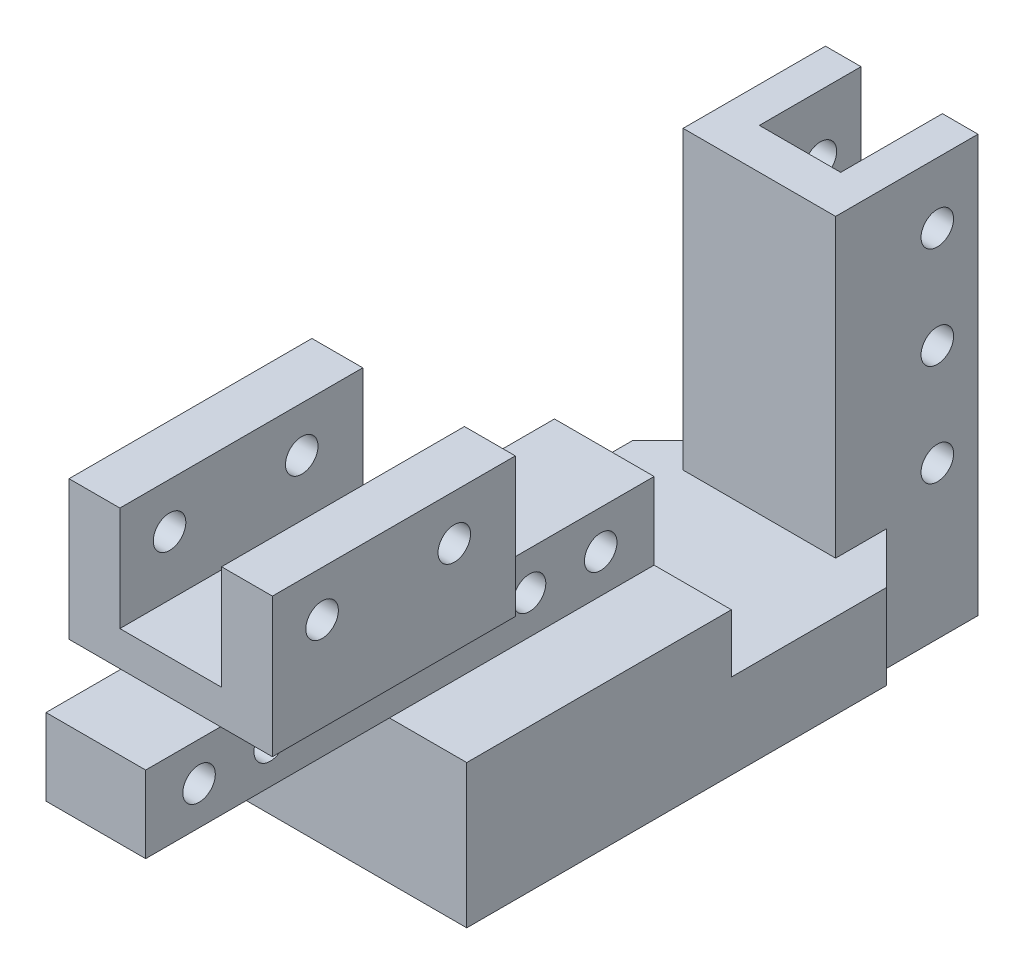
from build123d import *

# Parameters (mm, degrees)
SKETCH_2_W          = 50
SKETCH_2_H          = 7.55
SKETCH_2_R          = 1.6
EXTRUDE_1_DEPTH     = 4.9
SKETCH_3_W          = 23.885574904
SKETCH_3_H          = 13.680093874
SKETCH_3_R          = 1.6
EXTRUDE_2_DEPTH     = 10
SKETCH_4_W          = 10
SKETCH_4_H          = 10.264550668
CUT_EXTRUDE_1_DEPTH = 48.143107127
SKETCH_6_W          = 14
SKETCH_6_H          = 41
SKETCH_6_R          = 1.6
EXTRUDE_4_DEPTH     = 7.5
SKETCH_7_W          = 8
SKETCH_7_H          = 41
CUT_EXTRUDE_2_DEPTH = 10
EXTRUDE_5_DEPTH     = 12.5
CHAMFER_1_SIZE      = 5


with BuildPart() as part:
    # 草图2 → 凸台-拉伸1 (new, symmetric)
    with BuildSketch(Plane(origin=(0, 0, 0), x_dir=(0, 0, -1), z_dir=(1, 0, 0))):
        with Locations((19.75, 0)):
            Rectangle(SKETCH_2_W, SKETCH_2_H)
        Circle(SKETCH_2_R, mode=Mode.SUBTRACT)
        with Locations((7, 0)):
            Circle(SKETCH_2_R, mode=Mode.SUBTRACT)
        with Locations((32.5, 0)):
            Circle(SKETCH_2_R, mode=Mode.SUBTRACT)
        with Locations((39.5, 0)):
            Circle(SKETCH_2_R, mode=Mode.SUBTRACT)
    extrude(amount=EXTRUDE_1_DEPTH, both=True)

    # 草图3 → 凸台-拉伸2 (add, symmetric)
    with BuildSketch(Plane(origin=(0, 0, 0), x_dir=(0, 0, -1), z_dir=(1, 0, 0))):
        with Locations((14.057212548, 10.615046937)):
            Rectangle(SKETCH_3_W, SKETCH_3_H)
        with Locations((7, 13)):
            Circle(SKETCH_3_R, mode=Mode.SUBTRACT)
        with Locations((20, 13)):
            Circle(SKETCH_3_R, mode=Mode.SUBTRACT)
    extrude(amount=EXTRUDE_2_DEPTH, both=True)

    # 草图4 → 切除-拉伸1 (cut, through all)
    with BuildSketch(Plane.XY.offset(-2.114425096)):
        with Locations((0, 12.32281854)):
            Rectangle(SKETCH_4_W, SKETCH_4_H)
    extrude(amount=-CUT_EXTRUDE_1_DEPTH, mode=Mode.SUBTRACT)



with BuildPart() as body_2:
    # 草图6 → 凸台-拉伸4 (new, symmetric)
    with BuildSketch(Plane(origin=(0, 0, 0), x_dir=(0, 0, -1), z_dir=(1, 0, 0))):
        with Locations((67, -0.9)):
            Rectangle(SKETCH_6_W, SKETCH_6_H)
        with Locations((70, 3.6)):
            Circle(SKETCH_6_R, mode=Mode.SUBTRACT)
        with Locations((70, 13.6)):
            Circle(SKETCH_6_R, mode=Mode.SUBTRACT)
        with Locations((70, -6.4)):
            Circle(SKETCH_6_R, mode=Mode.SUBTRACT)
    extrude(amount=EXTRUDE_4_DEPTH, both=True)

    # 草图7 → 切除-拉伸2 (cut)
    with BuildSketch(Plane.XY.offset(-74)):
        with Locations((0, -0.9)):
            Rectangle(SKETCH_7_W, SKETCH_7_H)
    extrude(amount=CUT_EXTRUDE_2_DEPTH, mode=Mode.SUBTRACT)


with BuildPart() as part_1:
    add(part.part)

    add(body_2.part)  # 凸台-拉伸5 merges body 2
    # 草图8 → 凸台-拉伸5 (add, symmetric)
    with BuildSketch(Plane(origin=(0, 0, 0), x_dir=(0, 0, -1), z_dir=(1, 0, 0))):
        Polygon((44.75, -3.775), (44.75, -9.506092627), (60, -9.506092627), (60, -17.854611286), (18.724521107, -17.854611286), (18.724521107, -3.775), align=None)
    extrude(amount=EXTRUDE_5_DEPTH, both=True)

    # 倒角1
    chamfer_1_edges = [part_1.edges().sort_by_distance(p)[0] for p in [
        (-7.5, -13.680351956, -60),
        (7.5, -13.680351956, -60),
    ]]
    chamfer(chamfer_1_edges, length=CHAMFER_1_SIZE - 0.0001)  # a hair under: the kernel refuses the full size


solid = part_1.part
